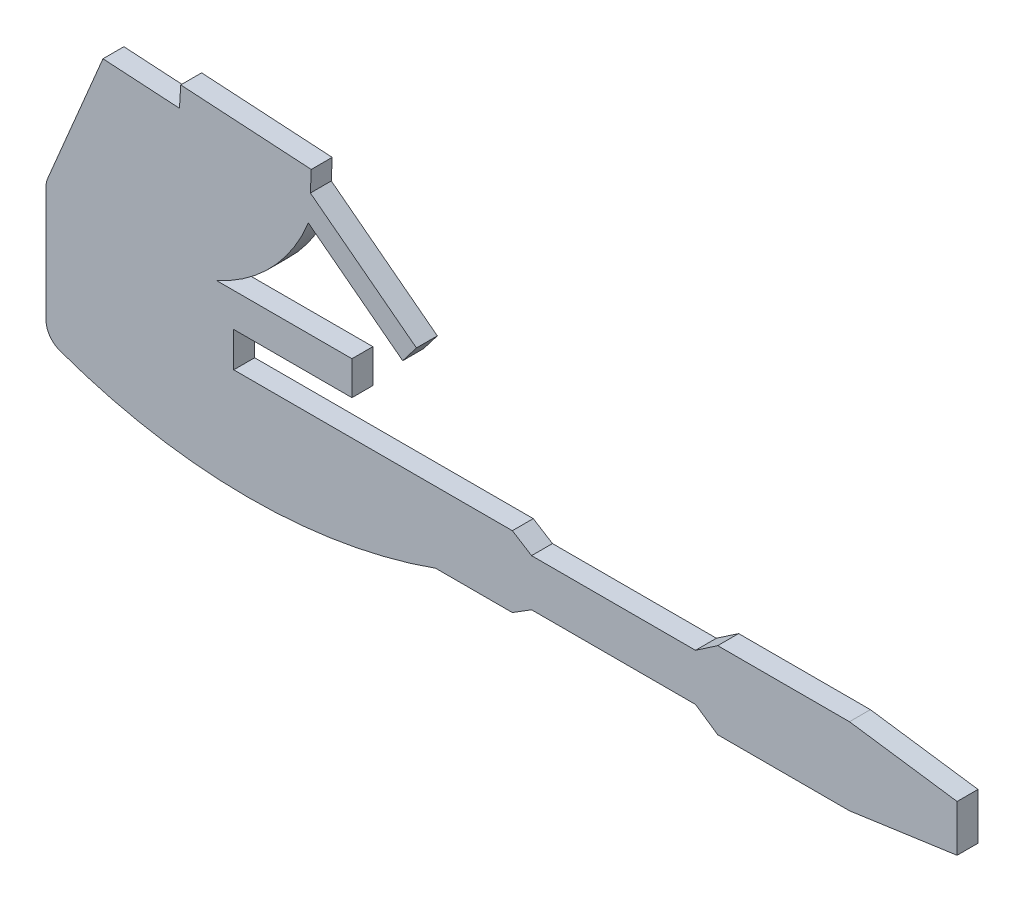
from build123d import *

# Parameters (mm, degrees)
BOSS_EXTRUDE1_DEPTH = 1.524


with BuildPart() as part:
    # Sketch1 → Boss-Extrude1 (new body)
    with BuildSketch(Plane.XY):
        with BuildLine():
            Line((-76.754205211, -61.174188006), (-76.661863965, -59.65298812))
            Line((-76.661863965, -59.65298812), (-67.149535541, -60.230414046))
            Line((-67.149535541, -60.230414046), (-67.213791765, -61.753318775))
            Line((-67.213791765, -61.753318775), (-59.486437278, -67.663843837))
            Line((-59.486437278, -67.663843837), (-60.486131122, -68.97083241))
            Line((-60.486131122, -68.97083241), (-67.360904175, -63.712432722))
            ThreePointArc((-67.360904175, -63.712432722), (-70.03177356, -67.84953452), (-74.051916255, -70.693406399))
            Line((-74.051916255, -70.693406399), (-64.185143516, -70.693406399))
            Line((-64.185143516, -70.693406399), (-64.185143516, -73.153043733))
            Line((-64.185143516, -73.153043733), (-72.798340982, -73.153043733))
            Line((-72.798340982, -73.153043733), (-72.798340982, -75.701847065))
            Line((-72.798340982, -75.701847065), (-52.495804097, -75.701847065))
            Line((-52.495804097, -75.701847065), (-51.096682465, -76.577124287))
            Line((-51.096682465, -76.577124287), (-39.149886263, -76.577124287))
            Line((-39.149886263, -76.577124287), (-37.532315425, -75.474436357))
            Line((-37.532315425, -75.474436357), (-27.931703094, -75.474436357))
            Line((-27.931703094, -75.474436357), (-20.089286023, -76.58672614))
            Line((-20.089286023, -76.58672614), (-20.089286023, -79.984877009))
            Line((-20.089286023, -79.984877009), (-27.931703094, -81.097166791))
            Line((-27.931703094, -81.097166791), (-37.532315425, -81.097166791))
            Line((-37.532315425, -81.097166791), (-39.149886263, -79.994478861))
            Line((-39.149886263, -79.994478861), (-51.096682465, -79.994478861))
            Line((-51.096682465, -79.994478861), (-52.495804097, -80.869756084))
            Line((-52.495804097, -80.869756084), (-58.084123009, -80.869756084))
            ThreePointArc((-58.084123009, -80.869756084), (-71.781177958, -83.22758545), (-85.471038175, -80.828335395))
            ThreePointArc((-85.471038175, -80.828335395), (-86.201758041, -80.270751478), (-86.478940241, -79.394383191))
            Line((-86.478940241, -79.394383191), (-86.478940241, -71.001206962))
            ThreePointArc((-86.478940241, -71.001206962), (-86.448776905, -70.699498454), (-86.359480892, -70.409732906))
            Line((-86.359480892, -70.409732906), (-82.327771598, -60.83585636))
            Line((-82.327771598, -60.83585636), (-76.754205211, -61.174188006))
        make_face()
    extrude(amount=BOSS_EXTRUDE1_DEPTH)


solid = part.part
